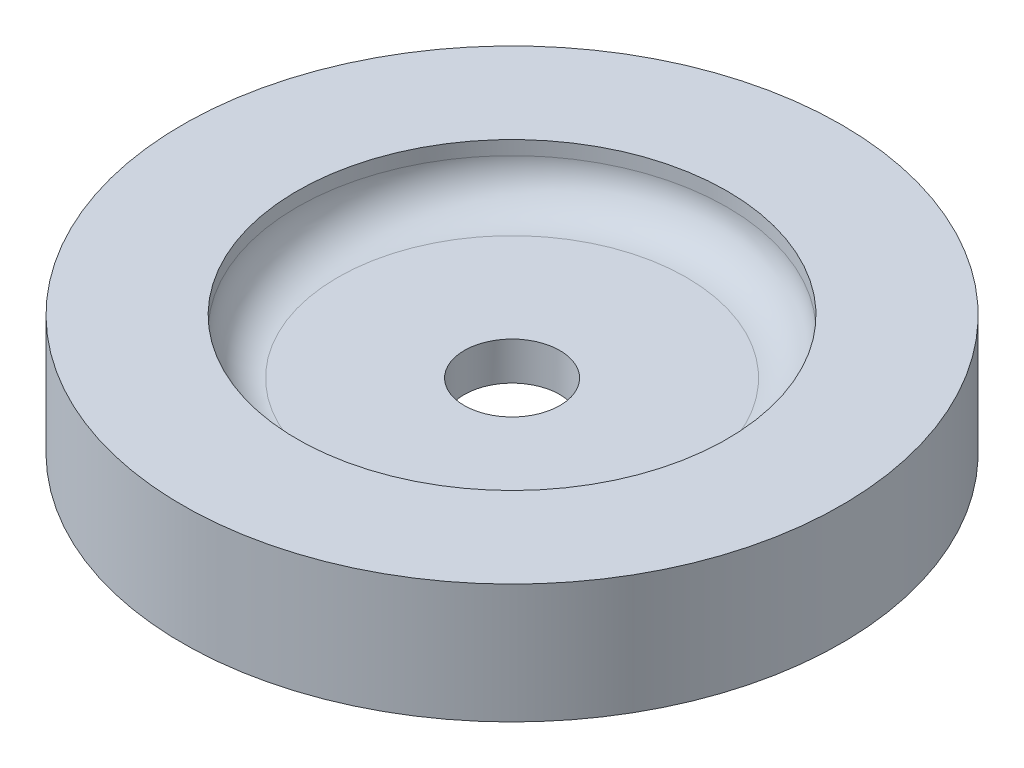
from build123d import *

# Parameters (mm, degrees)
FILLET2_R              = 10.795
F_1_1_DIAMETER_HOLE1_D = 25.4


with BuildPart() as part:
    # Sketch1 → Revolve1 (revolve)
    with BuildSketch(Plane.XY, mode=Mode.PRIVATE) as revolve1_sk:
        Polygon((87.63, 0), (57.15, 0), (57.15, 7.0866), (0, 7.0866), (0, 17.2466), (57.15, 17.2466), (57.15, 31.75), (87.63, 31.75), align=None)
    revolve(revolve1_sk.sketch.rotate(Axis((0, 7.0866, 0), (0, 1, 0)), 90), axis=Axis((0, 7.0866, 0), (0, 1, 0)))

    # Fillet2
    # the kernel refuses this fillet: 10.795 mm, written as the material it adds along each edge
    with BuildSketch(Plane(origin=(0, 17.2466, 0), x_dir=(0, 0, -1), z_dir=(1, 0, 0))) as fillet2_piece_1:
        with BuildLine():
            CenterArc((57.15 - FILLET2_R, FILLET2_R), FILLET2_R, 270, 90)
            Line((57.15, FILLET2_R), (57.15 + FILLET2_R * 0.02, FILLET2_R))
            Line((57.15 + FILLET2_R * 0.02, FILLET2_R), (57.15 + FILLET2_R * 0.02, -FILLET2_R * 0.02))
            Line((57.15 + FILLET2_R * 0.02, -FILLET2_R * 0.02), (57.15 - FILLET2_R, -FILLET2_R * 0.02))
            Line((57.15 - FILLET2_R, -FILLET2_R * 0.02), (57.15 - FILLET2_R, 0))
        make_face()
    revolve(axis=Axis((0, 17.2466, 0), (0, 1, 0)))
    with BuildSketch(Plane(origin=(0, 7.0866, 0), x_dir=(0, 0, -1), z_dir=(1, 0, 0))) as fillet2_piece_2:
        with BuildLine():
            CenterArc((47.011962989, -10.795), FILLET2_R, 20.092051419, 69.907948581)
            Line((47.011962989, 0), (47.011962989, 0.2159))
            Line((47.011962989, 0.2159), (57.15, 0.2159))
            Line((57.15, 0.2159), (57.3659, 0))
            ThreePointArc((57.3659, 0), (57.3659, -3.5433), (57.35276074, -7.012432))
            Line((57.35276074, -7.012432), (57.15, -7.0866))
        make_face()
    revolve(axis=Axis((0, 7.0866, 0), (0, 1, 0)))

    # 1 (1) Diameter Hole1 (through all)
    with Locations(Plane(origin=(0, 17.2466, 0), x_dir=(1, 0, 0), z_dir=(0, 1, 0))):
        with Locations((0, 0)):
            Hole(F_1_1_DIAMETER_HOLE1_D / 2)


solid = part.part
